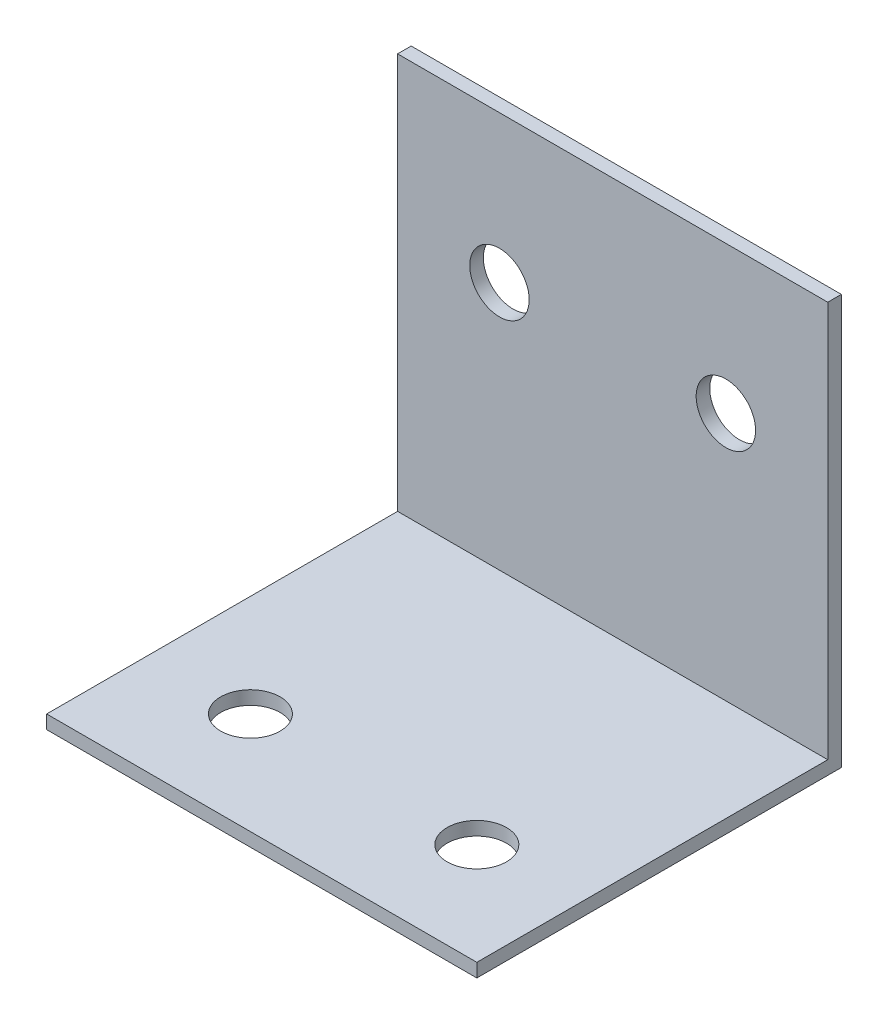
from build123d import *

# Parameters (mm, degrees)
SKETCH1_W           = 38
SKETCH1_H           = 32.2
SKETCH1_R           = 2.625
BOSS_EXTRUDE1_DEPTH = 1.2
SKETCH2_W           = 38
SKETCH2_H           = 1.2
BOSS_EXTRUDE2_DEPTH = 35
SKETCH3_R           = 2.625
CUT_EXTRUDE1_DEPTH  = 61.954409192


with BuildPart() as part:
    # Sketch1 → Boss-Extrude1 (new body)
    with BuildSketch(Plane(origin=(0, 0, 0), x_dir=(1, 0, 0), z_dir=(0, 1, 0))):
        with Locations((-19, -16.1)):
            Rectangle(SKETCH1_W, SKETCH1_H)
        with Locations((-29, -23.2)):
            Circle(SKETCH1_R, mode=Mode.SUBTRACT)
        with Locations((-9, -23.2)):
            Circle(SKETCH1_R, mode=Mode.SUBTRACT)
    extrude(amount=BOSS_EXTRUDE1_DEPTH)

    # Sketch2 → Boss-Extrude2 (add)
    with BuildSketch(Plane(origin=(0, 1.2, 0), x_dir=(1, 0, 0), z_dir=(0, 1, 0))):
        with Locations((-19, -0.6)):
            Rectangle(SKETCH2_W, SKETCH2_H)
    extrude(amount=BOSS_EXTRUDE2_DEPTH)

    # Sketch3 → Cut-Extrude1 (cut, through all)
    with BuildSketch(Plane.XY.offset(1.2)):
        with Locations((-29, 23.2)):
            Circle(SKETCH3_R)
        with Locations((-9, 23.2)):
            Circle(SKETCH3_R)
    extrude(amount=-CUT_EXTRUDE1_DEPTH, mode=Mode.SUBTRACT)


solid = part.part
